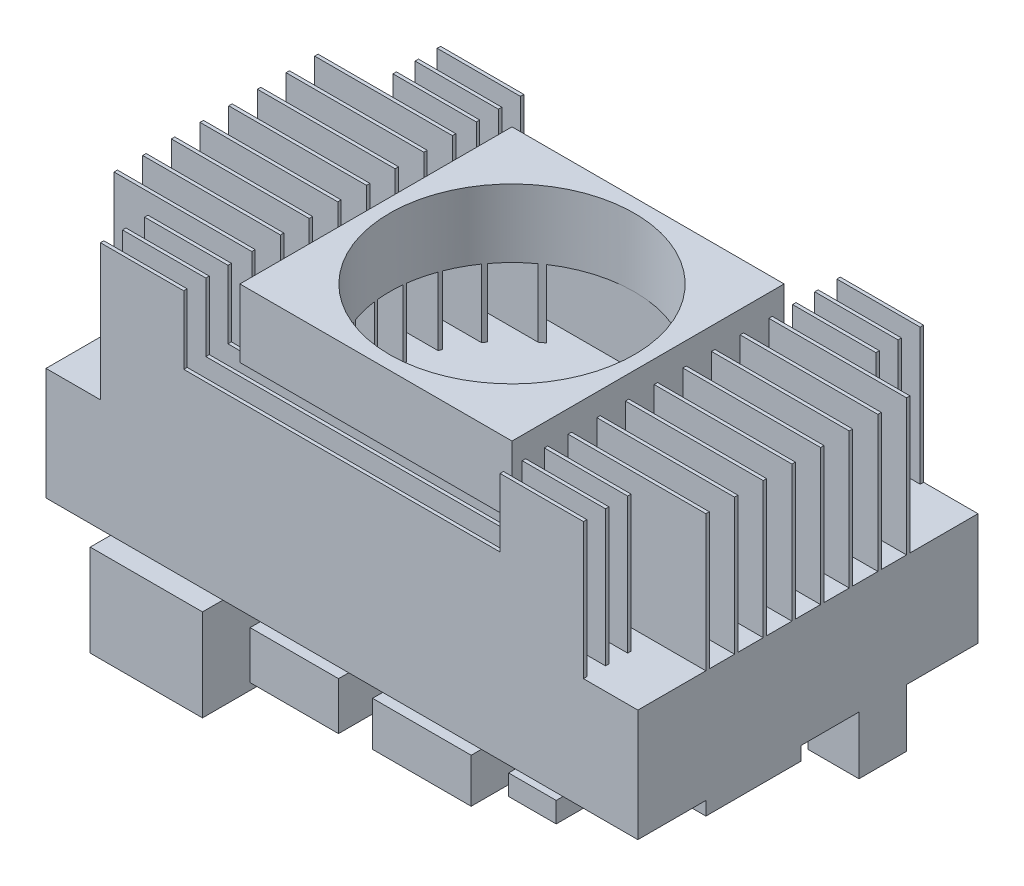
from build123d import *

# Parameters (mm, degrees)
FRONT_W                  = 87
FRONT_H                  = 52
EXTRUDE_1_DEPTH          = 50
UP_W                     = 8
UP_H                     = 8
UP_R                     = 18
CUT_EXTRUDE_1_DEPTH      = 20
CUT_EXTRUDE_2_DEPTH      = 104.658091821
CUT_EXTRUDE_2_DEPTH_BACK = 104.658091821
TUBES_W                  = 2.75
TUBES_H                  = 20
TUBES_W_2                = 3
TUBES_W_3                = 3.714285714
TUBES_W_4                = 3.714285715
UP_3_W                   = 46.5
UP_3_H                   = 50
UP_3_W_2                 = 40
UP_3_H_2                 = 40
CUT_EXTRUDE_3_DEPTH      = 10
UP_4_W                   = 40
UP_4_H                   = 40
UP_4_R                   = 18
EXTRUDE_2_DEPTH          = 10
INTERFACES_W             = 87
INTERFACES_H             = 15.5
CUT_EXTRUDE_4_DEPTH      = 72.191642768
EXTRUDE_3_DEPTH          = 3
EXTRUDE_3_DEPTH_BACK     = 30
INTERFACES_3_W           = 16.5
INTERFACES_3_H           = 13.5
EXTRUDE_4_DEPTH          = 1.5
EXTRUDE_4_DEPTH_BACK     = 15
INTERFACES_4_W           = 13
INTERFACES_4_H           = 7
EXTRUDE_5_DEPTH          = 1.5
EXTRUDE_5_DEPTH_BACK     = 9.5
INTERFACES_5_W           = 14.5
INTERFACES_5_H           = 6.5
EXTRUDE_6_DEPTH          = 1
EXTRUDE_6_DEPTH_BACK     = 3.5
INTERFACES_6_W           = 7
INTERFACES_6_H           = 3
SKETCH_5_W               = 15
SKETCH_5_H               = 14
EXTRUDE_7_DEPTH          = 2
SKETCH_5_3_W             = 0.5
SKETCH_5_3_H             = 0.5
SKETCH_5_3_W_2           = 7.5
SKETCH_5_3_H_2           = 7
EXTRUDE_8_DEPTH          = 8.5


with BuildPart() as part:
    # Front → 凸台-拉伸1 (new body)
    with BuildSketch(Plane.XY):
        Rectangle(FRONT_W, FRONT_H)
    extrude(amount=-EXTRUDE_1_DEPTH)

    # Up → 切除-拉伸1 (cut)
    with BuildSketch(Plane(origin=(0, 26, 0), x_dir=(1, 0, 0), z_dir=(0, 1, 0))):
        with Locations((-39.5, 46)):
            Rectangle(UP_W, UP_H)
        with Locations((-39.5, 4)):
            Rectangle(UP_W, UP_H)
        with Locations((39.5, 46)):
            Rectangle(UP_W, UP_H)
        with Locations((39.5, 4)):
            Rectangle(UP_W, UP_H)
        with Locations((0, 25)):
            Circle(UP_R)
    extrude(amount=-CUT_EXTRUDE_1_DEPTH, mode=Mode.SUBTRACT)

    # Tubes → 切除-拉伸2 (cut, two sides: drawn at the far end of the back side and taken through both)
    with BuildSketch(Plane.ZY.offset(43.5).offset(-CUT_EXTRUDE_2_DEPTH_BACK)):
        with Locations((-48.125, 16)):
            Rectangle(TUBES_W, TUBES_H)
        with Locations((-44.875, 16)):
            Rectangle(TUBES_W, TUBES_H)
        with Locations((-41.5, 16)):
            Rectangle(TUBES_W_2, TUBES_H)
        with Locations((-37.642857143, 16)):
            Rectangle(TUBES_W_3, TUBES_H)
        with Locations((-33.428571428, 16)):
            Rectangle(TUBES_W_4, TUBES_H)
        with Locations((-29.214285714, 16)):
            Rectangle(TUBES_W_3, TUBES_H)
        with Locations((-25, 16)):
            Rectangle(TUBES_W_3, TUBES_H)
        with Locations((-20.785714286, 16)):
            Rectangle(TUBES_W_3, TUBES_H)
        with Locations((-16.571428572, 16)):
            Rectangle(TUBES_W_4, TUBES_H)
        with Locations((-12.357142857, 16)):
            Rectangle(TUBES_W_3, TUBES_H)
        with Locations((-8.5, 16)):
            Rectangle(TUBES_W_2, TUBES_H)
        with Locations((-5.125, 16)):
            Rectangle(TUBES_W, TUBES_H)
        with Locations((-1.875, 16)):
            Rectangle(TUBES_W, TUBES_H)
    extrude(amount=CUT_EXTRUDE_2_DEPTH + CUT_EXTRUDE_2_DEPTH_BACK, mode=Mode.SUBTRACT)

    # Up<3> → 切除-拉伸3 (cut)
    with BuildSketch(Plane(origin=(0, 26, 0), x_dir=(1, 0, 0), z_dir=(0, 1, 0))):
        with Locations((0, 25)):
            Rectangle(UP_3_W, UP_3_H)
        with Locations((0, 25)):
            Rectangle(UP_3_W_2, UP_3_H_2, mode=Mode.SUBTRACT)
    extrude(amount=-CUT_EXTRUDE_3_DEPTH, mode=Mode.SUBTRACT)

    # Up<4> → 凸台-拉伸2 (add)
    with BuildSketch(Plane(origin=(0, 26, 0), x_dir=(1, 0, 0), z_dir=(0, 1, 0))):
        with Locations((0, 25)):
            Rectangle(UP_4_W, UP_4_H)
        with Locations((0, 25)):
            Circle(UP_4_R, mode=Mode.SUBTRACT)
    extrude(amount=-EXTRUDE_2_DEPTH)

    # Interfaces → 切除-拉伸4 (cut, through all)
    with BuildSketch(Plane.XY):
        with Locations((0, -18.25)):
            Rectangle(INTERFACES_W, INTERFACES_H)
    extrude(amount=-CUT_EXTRUDE_4_DEPTH, mode=Mode.SUBTRACT)

    # Interfaces<3> → 凸台-拉伸3 (add, two sides: drawn at the far end of the back side and taken through both)
    with BuildSketch(Plane.XY.offset(-EXTRUDE_3_DEPTH_BACK)):
        with Locations((-25.75, -17.25)):
            Rectangle(INTERFACES_3_W, INTERFACES_3_H)
    extrude(amount=EXTRUDE_3_DEPTH + EXTRUDE_3_DEPTH_BACK)

    # Interfaces<4> → 凸台-拉伸4 (add, two sides: drawn at the far end of the back side and taken through both)
    with BuildSketch(Plane.XY.offset(-EXTRUDE_4_DEPTH_BACK)):
        with Locations((-5.5, -14)):
            Rectangle(INTERFACES_4_W, INTERFACES_4_H)
    extrude(amount=EXTRUDE_4_DEPTH + EXTRUDE_4_DEPTH_BACK)

    # Interfaces<5> → 凸台-拉伸5 (add, two sides: drawn at the far end of the back side and taken through both)
    with BuildSketch(Plane.XY.offset(-EXTRUDE_5_DEPTH_BACK)):
        with Locations((13.25, -13.75)):
            Rectangle(INTERFACES_5_W, INTERFACES_5_H)
    extrude(amount=EXTRUDE_5_DEPTH + EXTRUDE_5_DEPTH_BACK)

    # Interfaces<6> → 凸台-拉伸6 (add, two sides: drawn at the far end of the back side and taken through both)
    with BuildSketch(Plane.XY.offset(-EXTRUDE_6_DEPTH_BACK)):
        with Locations((29, -12)):
            Rectangle(INTERFACES_6_W, INTERFACES_6_H)
    extrude(amount=EXTRUDE_6_DEPTH + EXTRUDE_6_DEPTH_BACK)

    # 草图5 → 凸台-拉伸7 (add)
    with BuildSketch(Plane.XZ.offset(10.5)):
        with Locations((36, -17)):
            Rectangle(SKETCH_5_W, SKETCH_5_H)
    extrude(amount=EXTRUDE_7_DEPTH)

    # 草图5<3> → 凸台-拉伸8 (add)
    with BuildSketch(Plane.XZ.offset(10.5)):
        with Locations((-38.75, -9.25)):
            Rectangle(SKETCH_5_3_W, SKETCH_5_3_H)
        with Locations((-41.25, -9.25)):
            Rectangle(SKETCH_5_3_W, SKETCH_5_3_H)
        with Locations((39.75, -36)):
            Rectangle(SKETCH_5_3_W_2, SKETCH_5_3_H_2)
        with Locations((-41.25, -11.75)):
            Rectangle(SKETCH_5_3_W, SKETCH_5_3_H)
        with Locations((-38.75, -11.75)):
            Rectangle(SKETCH_5_3_W, SKETCH_5_3_H)
        with Locations((-41.25, -14.25)):
            Rectangle(SKETCH_5_3_W, SKETCH_5_3_H)
        with Locations((-38.75, -14.25)):
            Rectangle(SKETCH_5_3_W, SKETCH_5_3_H)
        with Locations((-41.25, -16.75)):
            Rectangle(SKETCH_5_3_W, SKETCH_5_3_H)
        with Locations((-38.75, -16.75)):
            Rectangle(SKETCH_5_3_W, SKETCH_5_3_H)
        with Locations((-41.25, -19.25)):
            Rectangle(SKETCH_5_3_W, SKETCH_5_3_H)
        with Locations((-38.75, -19.25)):
            Rectangle(SKETCH_5_3_W, SKETCH_5_3_H)
        with Locations((-41.25, -21.75)):
            Rectangle(SKETCH_5_3_W, SKETCH_5_3_H)
        with Locations((-38.75, -21.75)):
            Rectangle(SKETCH_5_3_W, SKETCH_5_3_H)
        with Locations((-41.25, -24.25)):
            Rectangle(SKETCH_5_3_W, SKETCH_5_3_H)
        with Locations((-38.75, -24.25)):
            Rectangle(SKETCH_5_3_W, SKETCH_5_3_H)
        with Locations((-41.25, -26.75)):
            Rectangle(SKETCH_5_3_W, SKETCH_5_3_H)
        with Locations((-38.75, -26.75)):
            Rectangle(SKETCH_5_3_W, SKETCH_5_3_H)
        with Locations((-41.25, -29.25)):
            Rectangle(SKETCH_5_3_W, SKETCH_5_3_H)
        with Locations((-38.75, -29.25)):
            Rectangle(SKETCH_5_3_W, SKETCH_5_3_H)
        with Locations((-41.25, -31.75)):
            Rectangle(SKETCH_5_3_W, SKETCH_5_3_H)
        with Locations((-38.75, -31.75)):
            Rectangle(SKETCH_5_3_W, SKETCH_5_3_H)
    extrude(amount=EXTRUDE_8_DEPTH)


solid = part.part
